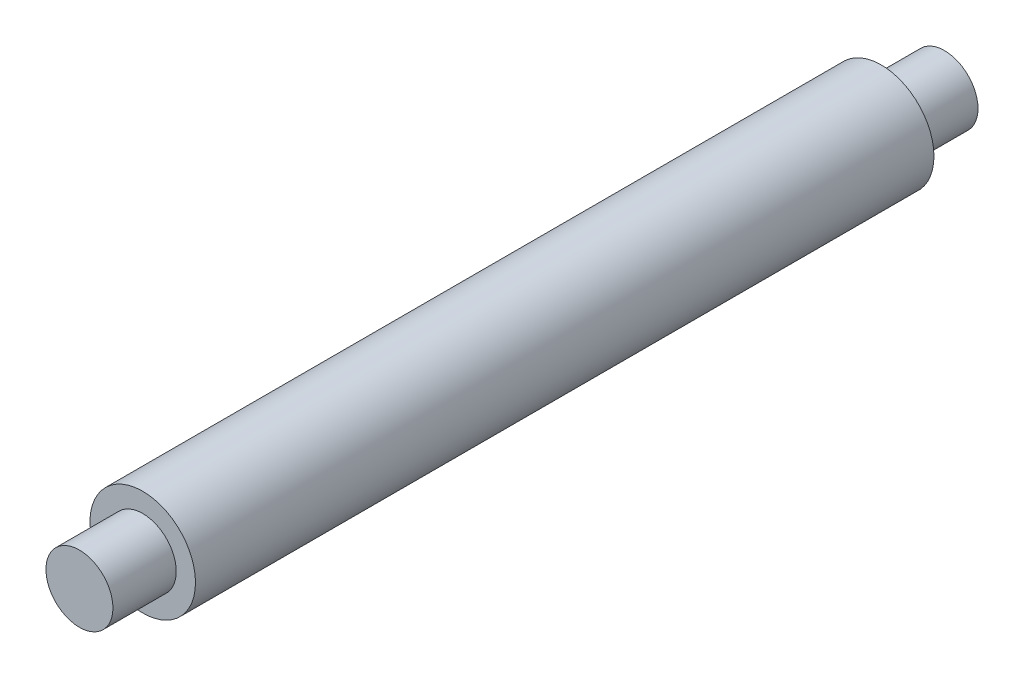
from build123d import *

# Parameters (mm, degrees)
SKETCH1_R           = 3.175
BOSS_EXTRUDE1_DEPTH = 41
SKETCH2_R           = 5
BOSS_EXTRUDE2_DEPTH = 35


with BuildPart() as part:
    # Sketch1 → Boss-Extrude1 (new, symmetric)
    with BuildSketch(Plane.XY):
        Circle(SKETCH1_R)
    extrude(amount=BOSS_EXTRUDE1_DEPTH, both=True)


with BuildPart() as body_2:
    # Sketch2 → Boss-Extrude2 (new, symmetric)
    with BuildSketch(Plane.XY):
        Circle(SKETCH2_R)
    extrude(amount=BOSS_EXTRUDE2_DEPTH, both=True)


solid = Compound([part.part, body_2.part])
